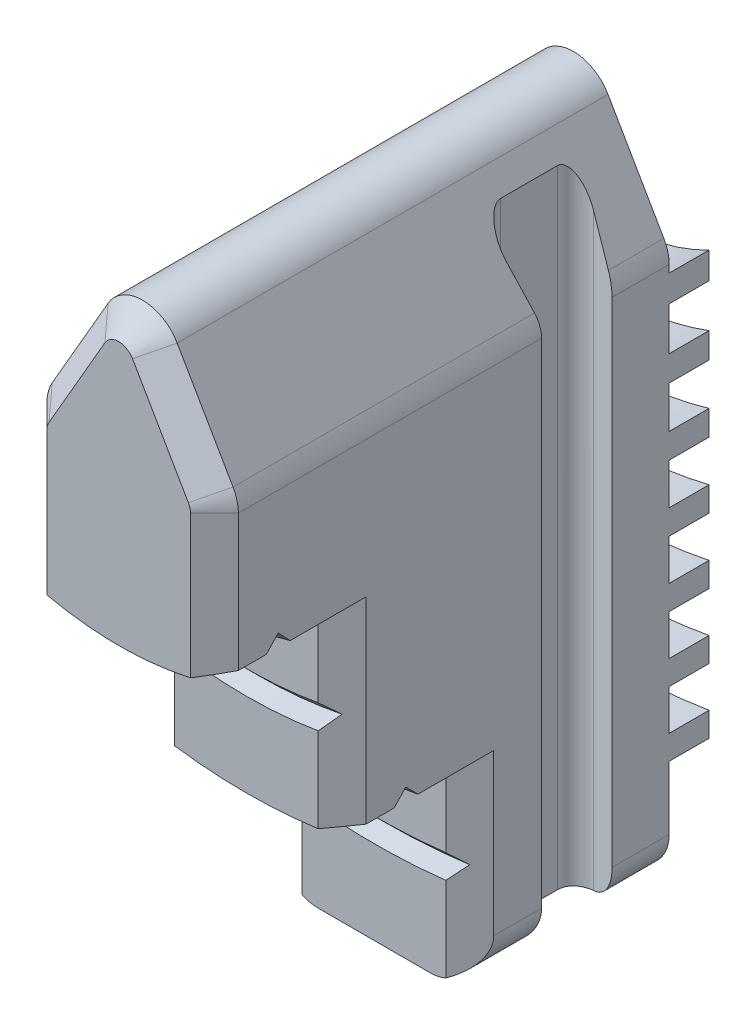
from build123d import *

# Parameters (mm, degrees)
BOSS_EXTRUDE1_START = 5
BOSS_EXTRUDE1_DEPTH = 57
SKETCH8_W           = 5
SKETCH8_H           = 3
REVOLVE1_ANGLE      = 90
SKETCH9_W           = 63.56376225
SKETCH9_H           = 92.375008695
SKETCH9_W_2         = 66.279802766
SKETCH9_H_2         = 103.815770587
CUT_EXTRUDE2_DEPTH  = 100
CUT_EXTRUDE3_DEPTH  = 100
CHAMFER4_SIZE       = 3
CHAMFER5_SIZE       = 3
CHAMFER7_SIZE       = 3
CHAMFER10_SIZE      = 3


with BuildPart() as part:
    # Sketch1 → Boss-Extrude1 (new body)
    with BuildSketch(Plane.XY.offset(BOSS_EXTRUDE1_START)):
        with BuildLine():
            Line((-4.330127019, -7.5), (-11.330127019, -19.624355653))
            ThreePointArc((-11.330127019, -19.624355653), (-11.829629131, -20.830260427), (-12, -22.124355653))
            Line((-12, -22.124355653), (-12, -84))
            ThreePointArc((-12, -84), (-10.535533906, -87.535533906), (-7, -89))
            Line((-7, -89), (7, -89))
            ThreePointArc((7, -89), (10.535533906, -87.535533906), (12, -84))
            Line((12, -84), (12, -22.124355653))
            ThreePointArc((12, -22.124355653), (11.829629131, -20.830260427), (11.330127019, -19.624355653))
            Line((11.330127019, -19.624355653), (4.330127019, -7.5))
            ThreePointArc((4.330127019, -7.5), (0, -5), (-4.330127019, -7.5))
        make_face()
    extrude(amount=BOSS_EXTRUDE1_DEPTH)

    # Sketch7 → Cut-Revolve2 (revolve, cut)
    with BuildSketch(Plane(origin=(0, 0, 0), x_dir=(0, 0, -1), z_dir=(1, 0, 0))):
        Polygon((-73.391777599, -41), (-62, -41), (-46, -41), (-46, -65), (-30, -65), (-30, -89), (-30, -99.200268773), (-73.391777599, -99.200268773), align=None)
        Polygon((-28.5, -77), (-30, -75.5), (-30, -78.5), align=None)
        Polygon((-38, -63.5), (-36.5, -65), (-39.5, -65), align=None)
        Polygon((-44.5, -53), (-46, -54.5), (-46, -51.5), align=None)
        Polygon((-54, -39.5), (-52.5, -41), (-55.5, -41), align=None)
    revolve(axis=Axis((0, 0, 0), (0, 0, 1)), mode=Mode.SUBTRACT)

    # Sketch8 → Revolve1 (revolve, symmetric)
    with BuildSketch(Plane(origin=(0, 0, 0), x_dir=(0, 0, -1), z_dir=(1, 0, 0))) as revolve1_sk:
        with Locations((-2.5, -35.5)):
            Rectangle(SKETCH8_W, SKETCH8_H)
        with Locations((-2.5, -27.5)):
            Rectangle(SKETCH8_W, SKETCH8_H)
        with Locations((-2.5, -43.5)):
            Rectangle(SKETCH8_W, SKETCH8_H)
        with Locations((-2.5, -51.5)):
            Rectangle(SKETCH8_W, SKETCH8_H)
        with Locations((-2.5, -59.5)):
            Rectangle(SKETCH8_W, SKETCH8_H)
        with Locations((-2.5, -67.5)):
            Rectangle(SKETCH8_W, SKETCH8_H)
        with Locations((-2.5, -75.5)):
            Rectangle(SKETCH8_W, SKETCH8_H)
    revolve(axis=Axis((0, 0, 22.869751467), (0, 0, -1)), revolution_arc=REVOLVE1_ANGLE / 2)
    revolve(revolve1_sk.sketch, axis=Axis((0, 0, 22.869751467), (0, 0, 1)), revolution_arc=REVOLVE1_ANGLE / 2)

    # Sketch9 → Cut-Extrude2 (cut)
    with BuildSketch(Plane(origin=(0, 0, 0), x_dir=(1, 0, 0), z_dir=(0, 1, 0))):
        with Locations((-43.781881125, -28.783671007)):
            Rectangle(SKETCH9_W, SKETCH9_H)
        with Locations((45.139901383, -26.868725236)):
            Rectangle(SKETCH9_W_2, SKETCH9_H_2)
    extrude(amount=-CUT_EXTRUDE2_DEPTH, mode=Mode.SUBTRACT)

    # Sketch10 → Cut-Extrude3 (cut)
    with BuildSketch(Plane(origin=(0, 0, 0), x_dir=(1, 0, 0), z_dir=(0, 1, 0))):
        with BuildLine():
            Line((12, -21), (12, -20.164136905))
            Line((12, -20.164136905), (12, -13))
            Line((12, -13), (12, -12.164136905))
            Line((12, -12.164136905), (8.601411599, -11.092566099))
            ThreePointArc((8.601411599, -11.092566099), (6.817380703, -11.387110791), (6, -13))
            Line((6, -13), (6, -20.164136905))
            ThreePointArc((6, -20.164136905), (6.817380703, -21.777026114), (8.601411599, -22.071570807))
            Line((8.601411599, -22.071570807), (12, -21))
        make_face()
        with BuildLine():
            Line((-12, -12.164136905), (-12, -13))
            Line((-12, -13), (-12, -20.164136905))
            Line((-12, -20.164136905), (-12, -21))
            Line((-12, -21), (-8.601411599, -22.071570807))
            ThreePointArc((-8.601411599, -22.071570807), (-6.817380703, -21.777026114), (-6, -20.164136905))
            Line((-6, -20.164136905), (-6, -13))
            ThreePointArc((-6, -13), (-6.817380703, -11.387110791), (-8.601411599, -11.092566099))
            Line((-8.601411599, -11.092566099), (-12, -12.164136905))
        make_face()
    extrude(amount=-CUT_EXTRUDE3_DEPTH, mode=Mode.SUBTRACT)

    # Chamfer4
    chamfer4_edges = [part.edges().sort_by_distance(p)[0] for p in [
        (12, -44.643511809, 46),
    ]]
    chamfer(chamfer4_edges, length=CHAMFER4_SIZE)

    # Chamfer5
    chamfer5_edges = [part.edges().sort_by_distance(p)[0] for p in [
        (11.829629131, -20.830260427, 62),
        (7.830127019, -13.562177826, 62),
        (0, -5, 62),
        (12, -30.66447361, 62),
        (-7.830127019, -13.562177826, 62),
        (-11.829629131, -20.830260427, 62),
        (-12, -30.66447361, 62),
    ]]
    chamfer(chamfer5_edges, length=CHAMFER5_SIZE)

    # Chamfer7
    chamfer7_edges = [part.edges().sort_by_distance(p)[0] for p in [
        (-12, -44.643511809, 46),
    ]]
    chamfer(chamfer7_edges, length=CHAMFER7_SIZE)

    # Chamfer10
    # the kernel refuses this chamfer: 3 mm, written as the material it takes off along each edge
    with BuildSketch(Plane(origin=(-12, -82.255306543, 30), x_dir=(0.9996219169112968, 0, 0.02749587661058678), z_dir=(0, 1, 0))) as chamfer10_piece_1_section:
        Polygon((CHAMFER10_SIZE * 0.999621916911, CHAMFER10_SIZE * 0.0274958766106), (-CHAMFER10_SIZE * 0.0274958766106, CHAMFER10_SIZE * 0.999621916911), (0, 0), align=None)
    chamfer10_piece_1 = extrude(amount=26.087650492, mode=Mode.PRIVATE)
    chamfer10_piece_1 = chamfer10_piece_1 - Plane(origin=(0, 0, 28.957588125), x_dir=(0, -1, 0), z_dir=(0, 0, -1)) * Cylinder(65, 65, mode=Mode.PRIVATE)
    add(chamfer10_piece_1, mode=Mode.SUBTRACT)
    with BuildSketch(Plane(origin=(-12, -91.715048964, 30), x_dir=(0.9996219169112968, 0, 0.02749587661058678), z_dir=(0, 1, 0)), Plane(origin=(12, -69.86233176, 30), x_dir=(-0.9996219169112968, 0, 0.02749587661058678), z_dir=(0, -1, 0))) as chamfer10_piece_2:
        Polygon((CHAMFER10_SIZE * 0.999621916911, CHAMFER10_SIZE * 0.0274958766106), (-CHAMFER10_SIZE * 0.0274958766106, CHAMFER10_SIZE * 0.999621916911), (0, 0), align=None)
    extrude(amount=21.852717204, mode=Mode.SUBTRACT)
    with BuildSketch(Plane(origin=(12, -56.167656051, 30), x_dir=(-0.9996219169112968, 0, 0.02749587661058678), z_dir=(0, -1, 0))) as chamfer10_piece_3_section:
        Polygon((CHAMFER10_SIZE * 0.999621916911, CHAMFER10_SIZE * 0.0274958766106), (-CHAMFER10_SIZE * 0.0274958766106, CHAMFER10_SIZE * 0.999621916911), (0, 0), align=None)
    chamfer10_piece_3 = extrude(amount=26.087650492, mode=Mode.PRIVATE)
    chamfer10_piece_3 = chamfer10_piece_3 - Plane(origin=(0, 0, 28.982814192), x_dir=(0, -1, 0), z_dir=(0, 0, -1)) * Cylinder(65, 65, mode=Mode.PRIVATE)
    add(chamfer10_piece_3, mode=Mode.SUBTRACT)


solid = part.part
